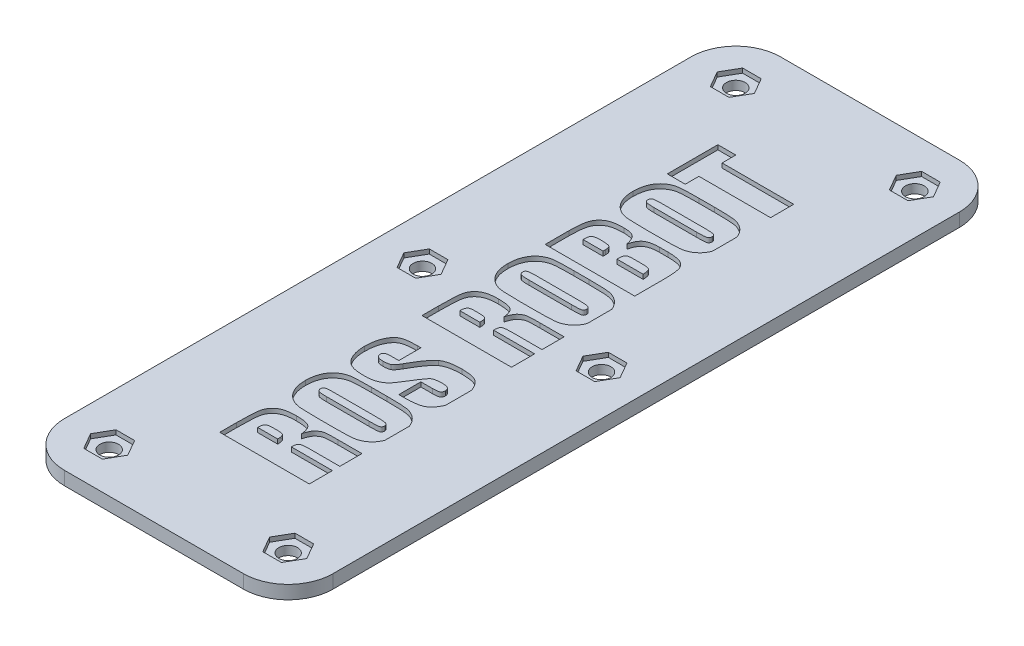
from build123d import *

# Parameters (mm, degrees)
SKETCH1_W           = 60
SKETCH1_H           = 160
BOSS_EXTRUDE1_DEPTH = 3
SKETCH2_R           = 2.09
CUT_EXTRUDE1_DEPTH  = 86.492689746
CUT_EXTRUDE2_DEPTH  = 1
FILLET1_R           = 10
CUT_EXTRUDE3_DEPTH  = 1


with BuildPart() as part:
    # Sketch1 → Boss-Extrude1 (new body)
    with BuildSketch(Plane(origin=(0, 0, 0), x_dir=(1, 0, 0), z_dir=(0, 1, 0))):
        Rectangle(SKETCH1_W, SKETCH1_H)
    extrude(amount=BOSS_EXTRUDE1_DEPTH)

    # Sketch2 → Cut-Extrude1 (cut, through all)
    with BuildSketch(Plane(origin=(0, 3, 0), x_dir=(1, 0, 0), z_dir=(0, 1, 0))):
        with Locations((-20, -70)):
            Circle(SKETCH2_R)
        with Locations((-20, 0)):
            Circle(SKETCH2_R)
        with Locations((-20, 70)):
            Circle(SKETCH2_R)
    cut_extrude1 = extrude(amount=-CUT_EXTRUDE1_DEPTH, mode=Mode.SUBTRACT)

    # Mirror1: Cut-Extrude1 across plane
    add(cut_extrude1.mirror(Plane(origin=(0, 0, 0), x_dir=(0, 0, 1), z_dir=(1, 0, 0))), mode=Mode.SUBTRACT)

    # Sketch3 → Cut-Extrude2 (cut)
    # profile 1 of 8: a face of its own
    with BuildSketch(Plane(origin=(0, 3, 0), x_dir=(1, 0, 0), z_dir=(0, 1, 0))):
        with BuildLine():
            Line((-10, -55.294117647), (10, -55.294117647))
            Line((10, -55.294117647), (10, -50.117647059))
            Line((10, -50.117647059), (0.823529412, -50.117647059))
            add(Edge.make_bspline(
                [(3.235294118, -48.470588235), (2.989040814, -48.472629573), (2.639050732, -48.472609959), (2.199316231, -48.504803837), (1.926897066, -48.533164663), (1.692438703, -48.569281782), (1.49574074, -48.610523448), (1.339038243, -48.665722106), (1.214579141, -48.728929145), (1.113981631, -48.811228735), (1.03929987, -48.923342767), (0.966657804, -49.054244329), (0.919353851, -49.217915347), (0.873311477, -49.403659462), (0.835597841, -49.707286412), (0.823973747, -49.948124989), (0.823529412, -50.117647059)],
                knots=[0, 0, 0, 0, 0.208735031, 0.296167179, 0.37344265, 0.440694545, 0.497112652, 0.543415123, 0.581035154, 0.614932476, 0.652105749, 0.694367553, 0.74131732, 0.795712192, 0.856498699, 1, 1, 1, 1], degree=3))
            Line((3.235294118, -48.470588235), (10, -48.470588235))
            Line((10, -48.470588235), (10, -43.529411765))
            Line((10, -43.529411765), (4.658088235, -43.529411765))
            add(Edge.make_bspline(
                [(-0.573529412, -46.408088235), (-0.508186487, -46.169202547), (-0.415807847, -45.822748493), (-0.253576942, -45.392429256), (-0.12424053, -45.117359412), (0.008181693, -44.872188688), (0.146242268, -44.65674583), (0.298199184, -44.475211831), (0.505595072, -44.279090918), (0.769482386, -44.085338589), (1.073939288, -43.890136431), (1.366818297, -43.747197915), (1.616256033, -43.665317475), (1.84380423, -43.628386957), (2.070329283, -43.598146442), (2.357684941, -43.579047523), (2.703272021, -43.560390596), (3.107774826, -43.546616069), (3.76580814, -43.52957415), (4.289261909, -43.534840608), (4.658088235, -43.529411765)],
                knots=[0, 0, 0, 0, 0.110210274, 0.159198398, 0.204303993, 0.245275902, 0.283065073, 0.3178845, 0.350264175, 0.409777515, 0.463155522, 0.510931222, 0.554366277, 0.579275166, 0.613344402, 0.65597887, 0.707279948, 0.767268001, 0.835955663, 1, 1, 1, 1], degree=3))
            add(Edge.make_bspline(
                [(-4.617647059, -43.529411765), (-4.265347321, -43.523568214), (-3.759919224, -43.547429474), (-3.118182503, -43.602500182), (-2.707546117, -43.670971052), (-2.343153143, -43.74912541), (-2.023822753, -43.845927278), (-1.754303785, -43.967615545), (-1.524564876, -44.105726294), (-1.330409182, -44.274272382), (-1.160503413, -44.475701558), (-1.010392486, -44.712065683), (-0.880561748, -44.983524654), (-0.777601525, -45.29095197), (-0.646430718, -45.763349146), (-0.597468225, -46.144266225), (-0.573529412, -46.408088235)],
                knots=[0, 0, 0, 0, 0.183843892, 0.264214308, 0.336184648, 0.401092358, 0.45878306, 0.510056682, 0.55517248, 0.59828253, 0.64368343, 0.692329227, 0.744143255, 0.800414159, 0.861431347, 1, 1, 1, 1], degree=3))
            add(Edge.make_bspline(
                [(-10, -51.566176471), (-10.002073268, -50.993819944), (-9.992522011, -50.173782937), (-9.961770188, -49.130967301), (-9.934349846, -48.461579038), (-9.893765625, -47.867125834), (-9.846902044, -47.348485673), (-9.793813546, -46.905287107), (-9.727924289, -46.526534008), (-9.642203621, -46.192709029), (-9.529610049, -45.884608598), (-9.3956181, -45.589803188), (-9.228198446, -45.311726309), (-9.031642664, -45.052332013), (-8.815602269, -44.802348856), (-8.564597704, -44.574834978), (-8.290441128, -44.355921653), (-7.977684947, -44.158035206), (-7.6226227, -43.990685169), (-7.226287928, -43.847046859), (-6.786918244, -43.730527587), (-6.30511939, -43.640302786), (-5.579003966, -43.54780148), (-5.009887783, -43.534831682), (-4.617647059, -43.529411765)],
                knots=[0, 0, 0, 0, 0.148881435, 0.213302999, 0.271376625, 0.323137581, 0.368275921, 0.406826982, 0.439217091, 0.468211877, 0.496345732, 0.524443445, 0.552325136, 0.580568943, 0.609027807, 0.638127546, 0.668547056, 0.700208954, 0.734143472, 0.770447799, 0.809729999, 0.852243566, 0.897872275, 1, 1, 1, 1], degree=3))
            Line((-10, -51.566176471), (-10, -55.294117647))
        make_face()
        with BuildLine():
            Line((-2.235294118, -50.117647059), (-6.705882353, -50.117647059))
            add(Edge.make_bspline(
                [(-5.154411765, -48.470588235), (-5.418336948, -48.473249493), (-5.788234319, -48.491488459), (-6.208983424, -48.648984539), (-6.422021915, -48.813415334), (-6.552252293, -49.050216126), (-6.691331049, -49.479623299), (-6.700787332, -49.853765331), (-6.705882353, -50.117647059)],
                knots=[0, 0, 0, 0, 0.296724354, 0.405999103, 0.497474067, 0.590179394, 0.702696619, 1, 1, 1, 1], degree=3))
            Line((-5.154411765, -48.470588235), (-4.047794118, -48.470588235))
            add(Edge.make_bspline(
                [(-2.235294118, -50.117647059), (-2.2410209, -49.859031368), (-2.244911105, -49.494151793), (-2.359520163, -49.070270281), (-2.445519037, -48.867401357), (-2.55713594, -48.745711405), (-2.670238573, -48.667444045), (-2.820402185, -48.608189394), (-3.001543379, -48.557137957), (-3.215789469, -48.518214901), (-3.567218076, -48.475786698), (-3.849445649, -48.476158465), (-4.047794118, -48.470588235)],
                knots=[0, 0, 0, 0, 0.26299036, 0.361622752, 0.442866927, 0.481355846, 0.526610603, 0.580321924, 0.643299483, 0.716253842, 0.799640904, 1, 1, 1, 1], degree=3))
        make_face(mode=Mode.SUBTRACT)
    # profile 2 of 8: a face of its own
    with BuildSketch(Plane(origin=(0, 3, 0), x_dir=(1, 0, 0), z_dir=(0, 1, 0))):
        Polygon((-6, 47.764705882), (10, 47.764705882), (10, 52.941176471), (-6, 52.941176471), (-6, 56), (-10, 56), (-10, 44.705882353), (-6, 44.705882353), align=None)
    # profile 3 of 8: a face of its own
    with BuildSketch(Plane(origin=(0, 3, 0), x_dir=(1, 0, 0), z_dir=(0, 1, 0))):
        with BuildLine():
            add(Edge.make_bspline(
                [(10, 34.798387464), (9.980984118, 34.748947528), (9.878125419, 34.490773842), (9.665995506, 34.04189974), (9.29388391, 33.497728263), (8.86835261, 33.004800818), (8.369272434, 32.590257778), (7.832614548, 32.241182509), (7.264792336, 31.970382533), (6.674408532, 31.776435539), (6.156196354, 31.68103348), (5.704959011, 31.640927748), (5.307854377, 31.611272108), (4.85186231, 31.586476739), (4.338407042, 31.563589566), (3.765971372, 31.55054095), (2.887326127, 31.534957706), (2.198536957, 31.530710798), (1.720588235, 31.529411765)],
                knots=[0.224411446, 0.224411446, 0.224411446, 0.224411446, 0.237202779, 0.291504649, 0.343987522, 0.396025725, 0.44835046, 0.500180972, 0.550381919, 0.599920811, 0.649928359, 0.677302448, 0.709372201, 0.746150888, 0.787647262, 0.833562824, 0.884505076, 1, 1, 1, 1], degree=3))
            Line((10, 34.798387464), (10, 40.27413404))
            add(Edge.make_bspline(
                [(1.720588235, 43.529411765), (2.188717266, 43.524898541), (2.862792337, 43.527597916), (3.724400067, 43.513585944), (4.286760579, 43.492638291), (4.795587242, 43.477264739), (5.249009688, 43.450877889), (5.647384029, 43.421695902), (6.101645014, 43.380381753), (6.624952968, 43.294588086), (7.219368568, 43.107710421), (7.784773996, 42.844615484), (8.318358198, 42.508884233), (8.812591488, 42.107273783), (9.245882126, 41.629826245), (9.620320483, 41.088913194), (9.855282283, 40.623994277), (9.971898719, 40.34504996), (10, 40.27413404)],
                knots=[0, 0, 0, 0, 0.11310055, 0.162848353, 0.208171349, 0.249055911, 0.285827126, 0.317890363, 0.34555357, 0.396029061, 0.44565955, 0.495598169, 0.546282494, 0.597611279, 0.648954578, 0.701516088, 0.756070273, 0.774486187, 0.774486187, 0.774486187, 0.774486187], degree=3))
            Line((1.720588235, 43.529411765), (-1.720588235, 43.529411765))
            add(Edge.make_bspline(
                [(-10.470588235, 37.529411765), (-10.471351287, 38.039260617), (-10.409632236, 38.787713715), (-10.190714791, 39.744932293), (-9.959732893, 40.402613519), (-9.663969879, 41.012578587), (-9.296625615, 41.560723652), (-8.866737602, 42.050148979), (-8.369656032, 42.465400462), (-7.831550666, 42.81302283), (-7.265834752, 43.089453187), (-6.675361322, 43.281308841), (-6.158763212, 43.378686195), (-5.707221304, 43.416729364), (-5.309410488, 43.453767498), (-4.851678447, 43.470262627), (-4.338450104, 43.496189179), (-3.765909196, 43.506679481), (-2.887460519, 43.533073835), (-2.19844543, 43.521822795), (-1.720588235, 43.529411765)],
                knots=[0, 0, 0, 0, 0.123193932, 0.180662712, 0.236860689, 0.291295599, 0.344027448, 0.395846617, 0.448174423, 0.500007975, 0.550340105, 0.599881904, 0.6496013, 0.676976995, 0.709367001, 0.746132344, 0.787631153, 0.833549409, 0.884500674, 1, 1, 1, 1], degree=3))
            add(Edge.make_bspline(
                [(-1.720588235, 31.529411765), (-2.18748944, 31.53391291), (-2.861570976, 31.531219141), (-3.723168413, 31.545315397), (-4.286784378, 31.565743736), (-4.794223549, 31.582937367), (-5.247897112, 31.603396478), (-5.646130949, 31.633658368), (-6.101982975, 31.674025142), (-6.624469402, 31.765639994), (-7.219562523, 31.950533989), (-7.785214435, 32.215513133), (-8.32114813, 32.547664842), (-8.814079121, 32.952950822), (-9.24365518, 33.431977579), (-9.621260416, 33.970332741), (-9.928263659, 34.576530151), (-10.169329369, 35.241134834), (-10.413124021, 36.222889843), (-10.465199955, 37.000791959), (-10.470588235, 37.529411765)],
                knots=[0, 0, 0, 0, 0.112808074, 0.162853494, 0.208177932, 0.249063796, 0.285524951, 0.317884488, 0.345548575, 0.39607688, 0.445708948, 0.495649157, 0.546586122, 0.597688037, 0.649251897, 0.701571856, 0.756127778, 0.812891824, 0.872063415, 1, 1, 1, 1], degree=3))
            Line((-1.720588235, 31.529411765), (1.720588235, 31.529411765))
        make_face()
        with BuildLine():
            Line((4.566176471, 36.705882353), (-4.959558824, 36.705882353))
            add(Edge.make_bspline(
                [(-7.176470588, 37.555147059), (-7.182599475, 37.429104515), (-7.138920866, 37.243468227), (-7.00068513, 37.037160926), (-6.880311142, 36.931046616), (-6.748139917, 36.863099127), (-6.606004763, 36.821896827), (-6.426365541, 36.786174375), (-6.207497569, 36.758825864), (-5.951560006, 36.731214092), (-5.530709236, 36.715263037), (-5.196278933, 36.703509135), (-4.959558824, 36.705882353)],
                knots=[0, 0, 0, 0, 0.141229944, 0.207870292, 0.277367941, 0.319365436, 0.37439268, 0.443449943, 0.525666756, 0.622809696, 0.733417226, 1, 1, 1, 1], degree=3))
            add(Edge.make_bspline(
                [(-4.959558824, 38.352941176), (-5.175303354, 38.352264386), (-5.482932653, 38.346448336), (-5.871602904, 38.333448647), (-6.115480155, 38.314251231), (-6.32757554, 38.292601849), (-6.508580133, 38.26906515), (-6.655852623, 38.235892117), (-6.805984555, 38.190248925), (-6.954005969, 38.106307017), (-7.143059215, 37.907812734), (-7.172463444, 37.690491789), (-7.176470588, 37.555147059)],
                knots=[0, 0, 0, 0, 0.245381507, 0.350013726, 0.44228014, 0.523562531, 0.592561096, 0.649714338, 0.695120491, 0.770678918, 0.840725622, 1, 1, 1, 1], degree=3))
            Line((-4.959558824, 38.352941176), (4.415441176, 38.352941176))
            add(Edge.make_bspline(
                [(7.176470588, 37.518382353), (7.174783202, 37.666908905), (7.135583707, 37.909491269), (6.90741784, 38.117636651), (6.72767083, 38.197953932), (6.545782298, 38.244701444), (6.363187256, 38.270798373), (6.140129485, 38.296901656), (5.875332367, 38.319122143), (5.568703908, 38.331807347), (5.07734344, 38.347878814), (4.688733611, 38.351487647), (4.415441176, 38.352941176)],
                knots=[0, 0, 0, 0, 0.144508876, 0.209626381, 0.282206802, 0.327424738, 0.385694884, 0.455209163, 0.538351522, 0.635125416, 0.743352513, 1, 1, 1, 1], degree=3))
            add(Edge.make_bspline(
                [(4.566176471, 36.705882353), (4.834553498, 36.710406485), (5.215756676, 36.707612663), (5.695131762, 36.721256936), (5.990199181, 36.742396681), (6.243241553, 36.757088503), (6.454082367, 36.783640941), (6.62251498, 36.811484319), (6.78643941, 36.851258818), (6.945563097, 36.933796701), (7.143111825, 37.144434325), (7.175688722, 37.373741892), (7.176470588, 37.518382353)],
                knots=[0, 0, 0, 0, 0.263965983, 0.374910105, 0.471520145, 0.554902094, 0.624118814, 0.680393612, 0.722784308, 0.789641701, 0.853612109, 1, 1, 1, 1], degree=3))
        make_face(mode=Mode.SUBTRACT)
    # profile 4 of 8: a face of its own
    with BuildSketch(Plane(origin=(0, 3, 0), x_dir=(1, 0, 0), z_dir=(0, 1, 0))):
        with BuildLine():
            Line((-10, 17.411764706), (10, 17.411764706))
            Line((10, 17.411764706), (10, 23.492647059))
            add(Edge.make_bspline(
                [(5.242647059, 29.647058824), (5.562644532, 29.646812462), (6.026827764, 29.635192846), (6.623446822, 29.584586988), (7.021215228, 29.534951021), (7.385674001, 29.468197782), (7.716316083, 29.388564201), (8.015408276, 29.293780096), (8.363234175, 29.14960596), (8.74665424, 28.927366376), (9.131049832, 28.58171603), (9.433497549, 28.164193669), (9.621221942, 27.757535454), (9.729179675, 27.375531482), (9.802121909, 27.017947482), (9.861860948, 26.594226079), (9.913076125, 26.102472039), (9.951814242, 25.545753948), (9.994365669, 24.668447698), (9.994351205, 23.976648658), (10, 23.492647059)],
                knots=[0, 0, 0, 0, 0.102268902, 0.148252963, 0.191287831, 0.230306444, 0.266587991, 0.299901488, 0.330446165, 0.386794172, 0.440584461, 0.494394702, 0.550463064, 0.582683787, 0.621084401, 0.666995037, 0.719365379, 0.779044003, 0.845298245, 1, 1, 1, 1], degree=3))
            Line((5.242647059, 29.647058824), (3.363970588, 29.647058824))
            add(Edge.make_bspline(
                [(-0.941176471, 26.632352941), (-0.878335362, 26.90637568), (-0.765762115, 27.300700064), (-0.56288787, 27.787632125), (-0.402673098, 28.106896555), (-0.22051409, 28.387346881), (-0.026797613, 28.636657687), (0.187839066, 28.84865708), (0.425229115, 29.024980417), (0.68715419, 29.172098002), (0.975506704, 29.302524236), (1.296825083, 29.40661881), (1.648075843, 29.494987923), (2.031115772, 29.56500852), (2.606138526, 29.628167049), (3.054773253, 29.646098611), (3.363970588, 29.647058824)],
                knots=[0, 0, 0, 0, 0.144042592, 0.209308729, 0.269932359, 0.32668049, 0.38029181, 0.431325131, 0.480651429, 0.531246854, 0.584898562, 0.642449522, 0.703940699, 0.770287073, 0.84166898, 1, 1, 1, 1], degree=3))
            add(Edge.make_bspline(
                [(-4.393382353, 29.411764706), (-4.126990133, 29.41598386), (-3.743106544, 29.396222444), (-3.256066937, 29.334964148), (-2.937604777, 29.279879292), (-2.653622433, 29.196253765), (-2.398933419, 29.104626632), (-2.178448506, 28.988432112), (-1.984982888, 28.854388338), (-1.816338677, 28.689065406), (-1.655843197, 28.498171445), (-1.516177065, 28.26689136), (-1.378311297, 28.007448391), (-1.248919057, 27.713445555), (-1.096259944, 27.252695911), (-0.993792729, 26.888687302), (-0.941176471, 26.632352941)],
                knots=[0, 0, 0, 0, 0.159635238, 0.229971647, 0.294226611, 0.35304997, 0.407212491, 0.456168779, 0.502023537, 0.547742778, 0.59730697, 0.651109669, 0.709268858, 0.77341036, 0.843331301, 1, 1, 1, 1], degree=3))
            add(Edge.make_bspline(
                [(-10, 22.716911765), (-9.995453326, 23.110291275), (-9.992088598, 23.681900263), (-9.952686927, 24.418555323), (-9.907114319, 24.913515961), (-9.856950367, 25.371064597), (-9.796114632, 25.791058651), (-9.718840383, 26.172456155), (-9.630921893, 26.520669601), (-9.523713394, 26.8423759), (-9.391200269, 27.143434389), (-9.23545347, 27.428259898), (-9.058703752, 27.698735988), (-8.855241863, 27.953140614), (-8.627607062, 28.191746973), (-8.374983504, 28.413745054), (-8.097680328, 28.621705733), (-7.786202266, 28.812643321), (-7.430102042, 28.973365406), (-7.029330489, 29.108122433), (-6.587251999, 29.22181161), (-6.099989949, 29.30427764), (-5.366465202, 29.389442028), (-4.791042127, 29.41614622), (-4.393382353, 29.411764706)],
                knots=[0, 0, 0, 0, 0.114375021, 0.166108066, 0.214389793, 0.258843936, 0.299904114, 0.337700596, 0.371916123, 0.404247528, 0.436150213, 0.467395744, 0.49851919, 0.529953016, 0.56195301, 0.594258892, 0.62760283, 0.662610335, 0.70023013, 0.740899013, 0.785395956, 0.832776928, 0.884431414, 1, 1, 1, 1], degree=3))
            Line((-10, 22.716911765), (-10, 17.411764706))
        make_face()
        with BuildLine():
            Line((-2.235294118, 22.588235294), (-6.705882353, 22.588235294))
            add(Edge.make_bspline(
                [(-4.794117647, 24.470588235), (-5.062170788, 24.473601667), (-5.431207161, 24.454740397), (-5.874896836, 24.37769061), (-6.108912695, 24.290930564), (-6.287926206, 24.18512451), (-6.427443444, 24.065629164), (-6.534581346, 23.932108827), (-6.604626234, 23.771096089), (-6.646964318, 23.56915724), (-6.693594331, 23.171954452), (-6.70169016, 22.835840711), (-6.705882353, 22.588235294)],
                knots=[0, 0, 0, 0, 0.246773781, 0.340005048, 0.413618877, 0.475394665, 0.530632455, 0.582131195, 0.631661098, 0.690822181, 0.771635832, 1, 1, 1, 1], degree=3))
            add(Edge.make_bspline(
                [(-2.246323529, 23.161764706), (-2.243112667, 23.394000556), (-2.271126629, 23.720444106), (-2.440251538, 24.083575852), (-2.592544184, 24.230993467), (-2.752742071, 24.301053962), (-2.914078937, 24.349390316), (-3.120807287, 24.381402351), (-3.370568825, 24.415860115), (-3.663910927, 24.439841122), (-4.142980969, 24.465850417), (-4.524499949, 24.47015933), (-4.794117647, 24.470588235)],
                knots=[0, 0, 0, 0, 0.207117208, 0.283923184, 0.350830951, 0.389245474, 0.438074134, 0.499906873, 0.574464838, 0.661754019, 0.760816726, 1, 1, 1, 1], degree=3))
            add(Edge.make_bspline(
                [(-2.235294118, 22.588235294), (-2.242972169, 22.874959549), (-2.246323529, 23.161764706)],
                knots=[0, 0, 0, 1, 1, 1], degree=2))
        make_face(mode=Mode.SUBTRACT)
        with BuildLine():
            Line((6.705882353, 22.588235294), (0.823529412, 22.588235294))
            add(Edge.make_bspline(
                [(2.783088235, 24.470588235), (2.580992751, 24.470303896), (2.291650025, 24.467503211), (1.931159289, 24.42775611), (1.707540562, 24.403304673), (1.520190342, 24.3573331), (1.363179519, 24.308705054), (1.24024349, 24.246433972), (1.143526711, 24.173634658), (1.073281433, 24.075604763), (1.016524158, 23.952965692), (0.965155439, 23.800026496), (0.922704046, 23.616434295), (0.886469189, 23.402786296), (0.845490318, 23.057438026), (0.830566506, 22.78210724), (0.823529412, 22.588235294)],
                knots=[0, 0, 0, 0, 0.18234372, 0.260036521, 0.32688627, 0.384748242, 0.433641625, 0.474638114, 0.508443963, 0.541575631, 0.582078258, 0.629925201, 0.686712704, 0.751712351, 0.82513553, 1, 1, 1, 1], degree=3))
            Line((2.783088235, 24.470588235), (4.746323529, 24.470588235))
            add(Edge.make_bspline(
                [(6.705882353, 22.588235294), (6.697406962, 22.77211117), (6.686457896, 23.035946827), (6.639035104, 23.366082296), (6.600446576, 23.57431779), (6.548534374, 23.75473471), (6.491147804, 23.909241382), (6.426347677, 24.037580991), (6.345277665, 24.139521751), (6.242531072, 24.219815984), (6.116989222, 24.290513523), (5.958992317, 24.342371017), (5.774048501, 24.391465703), (5.558475797, 24.426125537), (5.212916143, 24.460777173), (4.93906262, 24.475126558), (4.746323529, 24.470588235)],
                knots=[0, 0, 0, 0, 0.168583806, 0.241049478, 0.305039014, 0.362178465, 0.412572109, 0.455707222, 0.493180931, 0.530654639, 0.574325613, 0.624331078, 0.682257189, 0.749354057, 0.823771208, 1, 1, 1, 1], degree=3))
        make_face(mode=Mode.SUBTRACT)
    # profile 5 of 8: a face of its own
    with BuildSketch(Plane(origin=(0, 3, 0), x_dir=(1, 0, 0), z_dir=(0, 1, 0))):
        with BuildLine():
            add(Edge.make_bspline(
                [(10, 6.798387464), (9.980984118, 6.748947528), (9.878125419, 6.490773842), (9.665995506, 6.04189974), (9.29388391, 5.497728263), (8.86835261, 5.004800818), (8.369272434, 4.590257778), (7.832614548, 4.241182509), (7.264792336, 3.970382533), (6.674408532, 3.776435539), (6.156196354, 3.68103348), (5.704959011, 3.640927748), (5.307854377, 3.611272108), (4.85186231, 3.586476739), (4.338407042, 3.563589566), (3.765971372, 3.55054095), (2.887326127, 3.534957706), (2.198536957, 3.530710798), (1.720588235, 3.529411765)],
                knots=[0.224411446, 0.224411446, 0.224411446, 0.224411446, 0.237202779, 0.291504649, 0.343987522, 0.396025725, 0.44835046, 0.500180972, 0.550381919, 0.599920811, 0.649928359, 0.677302448, 0.709372201, 0.746150888, 0.787647262, 0.833562824, 0.884505076, 1, 1, 1, 1], degree=3))
            Line((10, 6.798387464), (10, 12.27413404))
            add(Edge.make_bspline(
                [(1.720588235, 15.529411765), (2.188717266, 15.524898541), (2.862792337, 15.527597916), (3.724400067, 15.513585944), (4.286760579, 15.492638291), (4.795587242, 15.477264739), (5.249009688, 15.450877889), (5.647384029, 15.421695902), (6.101645014, 15.380381753), (6.624952968, 15.294588086), (7.219368568, 15.107710421), (7.784773996, 14.844615484), (8.318358198, 14.508884233), (8.812591488, 14.107273783), (9.245882126, 13.629826245), (9.620320483, 13.088913194), (9.855282283, 12.623994277), (9.971898719, 12.34504996), (10, 12.27413404)],
                knots=[0, 0, 0, 0, 0.11310055, 0.162848353, 0.208171349, 0.249055911, 0.285827126, 0.317890363, 0.34555357, 0.396029061, 0.44565955, 0.495598169, 0.546282494, 0.597611279, 0.648954578, 0.701516088, 0.756070273, 0.774486187, 0.774486187, 0.774486187, 0.774486187], degree=3))
            Line((1.720588235, 15.529411765), (-1.720588235, 15.529411765))
            add(Edge.make_bspline(
                [(-10.470588235, 9.529411765), (-10.471351287, 10.039260617), (-10.409632236, 10.787713715), (-10.190714791, 11.744932293), (-9.959732893, 12.402613519), (-9.663969879, 13.012578587), (-9.296625615, 13.560723652), (-8.866737602, 14.050148979), (-8.369656032, 14.465400462), (-7.831550666, 14.81302283), (-7.265834752, 15.089453187), (-6.675361322, 15.281308841), (-6.158763212, 15.378686195), (-5.707221304, 15.416729364), (-5.309410488, 15.453767498), (-4.851678447, 15.470262627), (-4.338450104, 15.496189179), (-3.765909196, 15.506679481), (-2.887460519, 15.533073835), (-2.19844543, 15.521822795), (-1.720588235, 15.529411765)],
                knots=[0, 0, 0, 0, 0.123193932, 0.180662712, 0.236860689, 0.291295599, 0.344027448, 0.395846617, 0.448174423, 0.500007975, 0.550340105, 0.599881904, 0.6496013, 0.676976995, 0.709367001, 0.746132344, 0.787631153, 0.833549409, 0.884500674, 1, 1, 1, 1], degree=3))
            add(Edge.make_bspline(
                [(-1.720588235, 3.529411765), (-2.18748944, 3.53391291), (-2.861570976, 3.531219141), (-3.723168413, 3.545315397), (-4.286784378, 3.565743736), (-4.794223549, 3.582937367), (-5.247897112, 3.603396478), (-5.646130949, 3.633658368), (-6.101982975, 3.674025142), (-6.624469402, 3.765639994), (-7.219562523, 3.950533989), (-7.785214435, 4.215513133), (-8.32114813, 4.547664842), (-8.814079121, 4.952950822), (-9.24365518, 5.431977579), (-9.621260416, 5.970332741), (-9.928263659, 6.576530151), (-10.169329369, 7.241134834), (-10.413124021, 8.222889843), (-10.465199955, 9.000791959), (-10.470588235, 9.529411765)],
                knots=[0, 0, 0, 0, 0.112808074, 0.162853494, 0.208177932, 0.249063796, 0.285524951, 0.317884488, 0.345548575, 0.39607688, 0.445708948, 0.495649157, 0.546586122, 0.597688037, 0.649251897, 0.701571856, 0.756127778, 0.812891824, 0.872063415, 1, 1, 1, 1], degree=3))
            Line((-1.720588235, 3.529411765), (1.720588235, 3.529411765))
        make_face()
        with BuildLine():
            Line((4.566176471, 8.705882353), (-4.959558824, 8.705882353))
            add(Edge.make_bspline(
                [(-7.176470588, 9.555147059), (-7.182599475, 9.429104515), (-7.138920866, 9.243468227), (-7.00068513, 9.037160926), (-6.880311142, 8.931046616), (-6.748139917, 8.863099127), (-6.606004763, 8.821896827), (-6.426365541, 8.786174375), (-6.207497569, 8.758825864), (-5.951560006, 8.731214092), (-5.530709236, 8.715263037), (-5.196278933, 8.703509135), (-4.959558824, 8.705882353)],
                knots=[0, 0, 0, 0, 0.141229944, 0.207870292, 0.277367941, 0.319365436, 0.37439268, 0.443449943, 0.525666756, 0.622809696, 0.733417226, 1, 1, 1, 1], degree=3))
            add(Edge.make_bspline(
                [(-4.959558824, 10.352941176), (-5.175303354, 10.352264386), (-5.482932653, 10.346448336), (-5.871602904, 10.333448647), (-6.115480155, 10.314251231), (-6.32757554, 10.292601849), (-6.508580133, 10.26906515), (-6.655852623, 10.235892117), (-6.805984555, 10.190248925), (-6.954005969, 10.106307017), (-7.143059215, 9.907812734), (-7.172463444, 9.690491789), (-7.176470588, 9.555147059)],
                knots=[0, 0, 0, 0, 0.245381507, 0.350013726, 0.44228014, 0.523562531, 0.592561096, 0.649714338, 0.695120491, 0.770678918, 0.840725622, 1, 1, 1, 1], degree=3))
            Line((-4.959558824, 10.352941176), (4.415441176, 10.352941176))
            add(Edge.make_bspline(
                [(7.176470588, 9.518382353), (7.174783202, 9.666908905), (7.135583707, 9.909491269), (6.90741784, 10.117636651), (6.72767083, 10.197953932), (6.545782298, 10.244701444), (6.363187256, 10.270798373), (6.140129485, 10.296901656), (5.875332367, 10.319122143), (5.568703908, 10.331807347), (5.07734344, 10.347878814), (4.688733611, 10.351487647), (4.415441176, 10.352941176)],
                knots=[0, 0, 0, 0, 0.144508876, 0.209626381, 0.282206802, 0.327424738, 0.385694884, 0.455209163, 0.538351522, 0.635125416, 0.743352513, 1, 1, 1, 1], degree=3))
            add(Edge.make_bspline(
                [(4.566176471, 8.705882353), (4.834553498, 8.710406485), (5.215756676, 8.707612663), (5.695131762, 8.721256936), (5.990199181, 8.742396681), (6.243241553, 8.757088503), (6.454082367, 8.783640941), (6.62251498, 8.811484319), (6.78643941, 8.851258818), (6.945563097, 8.933796701), (7.143111825, 9.144434325), (7.175688722, 9.373741892), (7.176470588, 9.518382353)],
                knots=[0, 0, 0, 0, 0.263965983, 0.374910105, 0.471520145, 0.554902094, 0.624118814, 0.680393612, 0.722784308, 0.789641701, 0.853612109, 1, 1, 1, 1], degree=3))
        make_face(mode=Mode.SUBTRACT)
    # profile 6 of 8: a face of its own
    with BuildSketch(Plane(origin=(0, 3, 0), x_dir=(1, 0, 0), z_dir=(0, 1, 0))):
        with BuildLine():
            Line((-10, -10.117647059), (10, -10.117647059))
            Line((10, -10.117647059), (10, -4.941176471))
            Line((10, -4.941176471), (0.823529412, -4.941176471))
            add(Edge.make_bspline(
                [(3.235294118, -3.294117647), (2.989040814, -3.296158985), (2.639050732, -3.296139371), (2.199316231, -3.328333249), (1.926897066, -3.356694074), (1.692438703, -3.392811194), (1.49574074, -3.43405286), (1.339038243, -3.489251518), (1.214579141, -3.552458557), (1.113981631, -3.634758147), (1.03929987, -3.746872179), (0.966657804, -3.877773741), (0.919353851, -4.041444759), (0.873311477, -4.227188874), (0.835597841, -4.530815824), (0.823973747, -4.771654401), (0.823529412, -4.941176471)],
                knots=[0, 0, 0, 0, 0.208735031, 0.296167179, 0.37344265, 0.440694545, 0.497112652, 0.543415123, 0.581035154, 0.614932476, 0.652105749, 0.694367553, 0.74131732, 0.795712192, 0.856498699, 1, 1, 1, 1], degree=3))
            Line((3.235294118, -3.294117647), (10, -3.294117647))
            Line((10, -3.294117647), (10, 1.647058824))
            Line((10, 1.647058824), (4.658088235, 1.647058824))
            add(Edge.make_bspline(
                [(-0.573529412, -1.231617647), (-0.508186487, -0.992731958), (-0.415807847, -0.646277905), (-0.253576942, -0.215958668), (-0.12424053, 0.059111176), (0.008181693, 0.3042819), (0.146242268, 0.519724758), (0.298199184, 0.701258757), (0.505595072, 0.89737967), (0.769482386, 1.091132), (1.073939288, 1.286334157), (1.366818297, 1.429272673), (1.616256033, 1.511153114), (1.84380423, 1.548083631), (2.070329283, 1.578324146), (2.357684941, 1.597423065), (2.703272021, 1.616079992), (3.107774826, 1.629854519), (3.76580814, 1.646896438), (4.289261909, 1.64162998), (4.658088235, 1.647058824)],
                knots=[0, 0, 0, 0, 0.110210274, 0.159198398, 0.204303993, 0.245275902, 0.283065073, 0.3178845, 0.350264175, 0.409777515, 0.463155522, 0.510931222, 0.554366277, 0.579275166, 0.613344402, 0.65597887, 0.707279948, 0.767268001, 0.835955663, 1, 1, 1, 1], degree=3))
            add(Edge.make_bspline(
                [(-4.617647059, 1.647058824), (-4.265347321, 1.652902374), (-3.759919224, 1.629041114), (-3.118182503, 1.573970406), (-2.707546117, 1.505499536), (-2.343153143, 1.427345178), (-2.023822753, 1.33054331), (-1.754303785, 1.208855044), (-1.524564876, 1.070744294), (-1.330409182, 0.902198206), (-1.160503413, 0.70076903), (-1.010392486, 0.464404905), (-0.880561748, 0.192945934), (-0.777601525, -0.114481382), (-0.646430718, -0.586878558), (-0.597468225, -0.967795637), (-0.573529412, -1.231617647)],
                knots=[0, 0, 0, 0, 0.183843892, 0.264214308, 0.336184648, 0.401092358, 0.45878306, 0.510056682, 0.55517248, 0.59828253, 0.64368343, 0.692329227, 0.744143255, 0.800414159, 0.861431347, 1, 1, 1, 1], degree=3))
            add(Edge.make_bspline(
                [(-10, -6.389705882), (-10.002073268, -5.817349355), (-9.992522011, -4.997312349), (-9.961770188, -3.954496712), (-9.934349846, -3.28510845), (-9.893765625, -2.690655246), (-9.846902044, -2.172015085), (-9.793813546, -1.728816518), (-9.727924289, -1.35006342), (-9.642203621, -1.016238441), (-9.529610049, -0.70813801), (-9.3956181, -0.4133326), (-9.228198446, -0.135255721), (-9.031642664, 0.124138575), (-8.815602269, 0.374121732), (-8.564597704, 0.60163561), (-8.290441128, 0.820548935), (-7.977684947, 1.018435383), (-7.6226227, 1.185785419), (-7.226287928, 1.329423729), (-6.786918244, 1.445943001), (-6.30511939, 1.536167802), (-5.579003966, 1.628669108), (-5.009887783, 1.641638907), (-4.617647059, 1.647058824)],
                knots=[0, 0, 0, 0, 0.148881435, 0.213302999, 0.271376625, 0.323137581, 0.368275921, 0.406826982, 0.439217091, 0.468211877, 0.496345732, 0.524443445, 0.552325136, 0.580568943, 0.609027807, 0.638127546, 0.668547056, 0.700208954, 0.734143472, 0.770447799, 0.809729999, 0.852243566, 0.897872275, 1, 1, 1, 1], degree=3))
            Line((-10, -6.389705882), (-10, -10.117647059))
        make_face()
        with BuildLine():
            Line((-2.235294118, -4.941176471), (-6.705882353, -4.941176471))
            add(Edge.make_bspline(
                [(-5.154411765, -3.294117647), (-5.418336948, -3.296778905), (-5.788234319, -3.315017871), (-6.208983424, -3.472513951), (-6.422021915, -3.636944745), (-6.552252293, -3.873745538), (-6.691331049, -4.303152711), (-6.700787332, -4.677294743), (-6.705882353, -4.941176471)],
                knots=[0, 0, 0, 0, 0.296724354, 0.405999103, 0.497474067, 0.590179394, 0.702696619, 1, 1, 1, 1], degree=3))
            Line((-5.154411765, -3.294117647), (-4.047794118, -3.294117647))
            add(Edge.make_bspline(
                [(-2.235294118, -4.941176471), (-2.2410209, -4.68256078), (-2.244911105, -4.317681205), (-2.359520163, -3.893799693), (-2.445519037, -3.690930769), (-2.55713594, -3.569240816), (-2.670238573, -3.490973456), (-2.820402185, -3.431718806), (-3.001543379, -3.380667369), (-3.215789469, -3.341744313), (-3.567218076, -3.29931611), (-3.849445649, -3.299687877), (-4.047794118, -3.294117647)],
                knots=[0, 0, 0, 0, 0.26299036, 0.361622752, 0.442866927, 0.481355846, 0.526610603, 0.580321924, 0.643299483, 0.716253842, 0.799640904, 1, 1, 1, 1], degree=3))
        make_face(mode=Mode.SUBTRACT)
    # profile 7 of 8: a face of its own
    with BuildSketch(Plane(origin=(0, 3, 0), x_dir=(1, 0, 0), z_dir=(0, 1, 0))):
        with BuildLine():
            add(Edge.make_bspline(
                [(10, -24.797933282), (9.954712321, -24.921932371), (9.853998918, -25.178630702), (9.66764177, -25.54941368), (9.45914843, -25.909340871), (9.236781684, -26.239598194), (8.999069687, -26.536780418), (8.749649466, -26.802707831), (8.484081059, -27.036104581), (8.20217236, -27.235043433), (7.909621911, -27.406170353), (7.596805317, -27.538786556), (7.263292856, -27.650101611), (6.90106848, -27.745228003), (6.504964457, -27.819969672), (6.077327082, -27.887510977), (5.615954124, -27.937340123), (4.935999227, -27.987821131), (4.409444545, -27.999784328), (4.047794118, -28)],
                knots=[0.286193131, 0.286193131, 0.286193131, 0.286193131, 0.324638117, 0.36647626, 0.406957631, 0.445779823, 0.482361605, 0.517724123, 0.551885446, 0.58517537, 0.618126535, 0.650430981, 0.683967027, 0.720515684, 0.759451015, 0.801366796, 0.846634442, 0.894614826, 1, 1, 1, 1], degree=3))
            Line((10, -24.797933282), (10, -19.028387447))
            add(Edge.make_bspline(
                [(4.875, -16), (5.212235924, -15.998308673), (5.699832415, -16.013532504), (6.325640635, -16.070067848), (6.742235131, -16.122095276), (7.123627446, -16.196886289), (7.468984682, -16.283838341), (7.780065055, -16.385011418), (8.058285778, -16.508705216), (8.313949794, -16.656009443), (8.556973121, -16.827662161), (8.785816927, -17.033817412), (9.006723407, -17.265352113), (9.217895321, -17.528024577), (9.413112982, -17.823674404), (9.607942, -18.143294227), (9.805748963, -18.547089161), (9.932257587, -18.847030526), (10, -19.028387447)],
                knots=[0, 0, 0, 0, 0.107324697, 0.155096555, 0.199938691, 0.240857979, 0.278693097, 0.313224336, 0.344823203, 0.375394585, 0.406993451, 0.43931565, 0.473244831, 0.508753256, 0.546394925, 0.585922737, 0.62778092, 0.689366758, 0.689366758, 0.689366758, 0.689366758], degree=3))
            add(Edge.make_bspline(
                [(0.566176471, -16.9375), (0.806043702, -16.77003858), (1.211465721, -16.558891693), (1.810580448, -16.357268829), (2.324256078, -16.225991682), (2.890649038, -16.123687479), (3.744627839, -16.024389707), (4.413744653, -15.999987273), (4.875, -16)],
                knots=[0, 0, 0, 0, 0.19599711, 0.304678492, 0.423526134, 0.551406495, 0.69050554, 1, 1, 1, 1], degree=3))
            add(Edge.make_bspline(
                [(-2.783088235, -21.529411765), (-2.473367773, -20.970305965), (-2.018375264, -20.172909867), (-1.388063598, -19.189740388), (-0.956308764, -18.573813667), (-0.552231412, -18.038870295), (-0.067679288, -17.480460132), (0.302443276, -17.119384349), (0.566176471, -16.9375)],
                knots=[0, 0, 0, 0, 0.335277756, 0.481299959, 0.612364063, 0.729738585, 0.83271341, 1, 1, 1, 1], degree=3))
            add(Edge.make_bspline(
                [(-4.007352941, -23.044117647), (-3.908726816, -22.995337919), (-3.763485988, -22.89204074), (-3.578339598, -22.716456053), (-3.431720611, -22.539134867), (-3.274066191, -22.334418219), (-3.049218613, -21.999638416), (-2.892754352, -21.722308394), (-2.783088235, -21.529411765)],
                knots=[0, 0, 0, 0, 0.16675308, 0.269572473, 0.387215686, 0.516181657, 0.662459423, 1, 1, 1, 1], degree=3))
            add(Edge.make_bspline(
                [(-5.573529412, -23.294117647), (-5.268536496, -23.296326908), (-4.735456987, -23.266606811), (-4.213860364, -23.143358219), (-4.007352941, -23.044117647)],
                knots=[0, 0, 0, 0, 0.572651319, 1, 1, 1, 1], degree=3))
            add(Edge.make_bspline(
                [(-7.176470588, -22.272058824), (-7.175318321, -22.422382216), (-7.133916453, -22.652559624), (-6.956363272, -22.898626556), (-6.777858689, -23.049357016), (-6.547345801, -23.163822977), (-6.142731079, -23.266997244), (-5.81087743, -23.300706927), (-5.573529412, -23.294117647)],
                knots=[0, 0, 0, 0, 0.212113464, 0.31285869, 0.41856281, 0.535755935, 0.669150346, 1, 1, 1, 1], degree=3))
            add(Edge.make_bspline(
                [(-5.463235294, -21.411764706), (-5.764999618, -21.411775508), (-6.172259272, -21.420944293), (-6.645795321, -21.504577171), (-6.867179393, -21.59295536), (-7.015763217, -21.718292422), (-7.143674268, -21.940278977), (-7.181903344, -22.135550089), (-7.176470588, -22.272058824)],
                knots=[0, 0, 0, 0, 0.412530825, 0.5543248, 0.654755758, 0.734265772, 0.814634242, 1, 1, 1, 1], degree=3))
            Line((-5.463235294, -21.411764706), (-3.882352941, -21.411764706))
            Line((-3.882352941, -21.411764706), (-3.882352941, -16.470588235))
            Line((-3.882352941, -16.470588235), (-4.6875, -16.470588235))
            add(Edge.make_bspline(
                [(-10.470588235, -22.433823529), (-10.468055857, -22.099065103), (-10.45338162, -21.605945973), (-10.383236947, -20.964085), (-10.310475123, -20.511039039), (-10.213647039, -20.077159513), (-10.102043994, -19.661176237), (-9.964067719, -19.266804184), (-9.811063405, -18.891644607), (-9.63946446, -18.542127161), (-9.456959463, -18.220290347), (-9.258542216, -17.933561399), (-9.061274222, -17.668635547), (-8.839161064, -17.446049206), (-8.616983988, -17.2427572), (-8.37698945, -17.07859539), (-8.122327288, -16.940479705), (-7.838398187, -16.830854873), (-7.51975516, -16.730671229), (-7.154877727, -16.652900468), (-6.748162271, -16.581526248), (-6.294893947, -16.532829805), (-5.603934436, -16.481907954), (-5.062596295, -16.470960066), (-4.6875, -16.470588235)],
                knots=[0, 0, 0, 0, 0.103074516, 0.1516425, 0.198645931, 0.244221725, 0.288418755, 0.331122695, 0.372729792, 0.413046579, 0.450895281, 0.486465125, 0.520340719, 0.552350623, 0.583079291, 0.612898617, 0.641587226, 0.672055515, 0.706414833, 0.744299228, 0.786776018, 0.833469693, 0.884529575, 1, 1, 1, 1], degree=3))
            add(Edge.make_bspline(
                [(-4.786764706, -28.235294118), (-5.148252189, -28.229904379), (-5.672108777, -28.222936356), (-6.342020821, -28.155500003), (-6.786560757, -28.091071009), (-7.192892425, -28.006245663), (-7.561802534, -27.906291969), (-7.889279126, -27.780339706), (-8.183003162, -27.639202273), (-8.448602585, -27.474416935), (-8.693163012, -27.285392797), (-8.929597443, -27.079329609), (-9.143134685, -26.842812469), (-9.347943873, -26.586901064), (-9.538843121, -26.308886347), (-9.71100803, -26.005284687), (-9.9259027, -25.56649327), (-10.146603568, -24.965093143), (-10.411380502, -23.885130997), (-10.470239671, -23.0240668), (-10.470588235, -22.433823529)],
                knots=[0, 0, 0, 0, 0.115094371, 0.166420003, 0.214115061, 0.257929727, 0.298417601, 0.335563099, 0.369390983, 0.401957355, 0.434786392, 0.467650138, 0.501587937, 0.535990613, 0.571893796, 0.608743473, 0.646930183, 0.727243377, 0.811970216, 1, 1, 1, 1], degree=3))
            add(Edge.make_bspline(
                [(1.323529412, -23.977941176), (1.131175782, -24.294407689), (0.853854405, -24.747091531), (0.486700712, -25.315444229), (0.246545695, -25.677903122), (0.023994059, -25.995249819), (-0.173199106, -26.270775338), (-0.348922133, -26.504176854), (-0.560178172, -26.756225593), (-0.838522668, -27.032061417), (-1.219833144, -27.321955364), (-1.657111427, -27.582564064), (-2.149901427, -27.816746262), (-2.707855507, -28.01086208), (-3.591829962, -28.187012068), (-4.29540431, -28.241859841), (-4.786764706, -28.235294118)],
                knots=[0, 0, 0, 0, 0.139505929, 0.199942303, 0.254866781, 0.303272613, 0.345933972, 0.382494964, 0.413288554, 0.469758671, 0.52967984, 0.593250504, 0.661184865, 0.734906166, 0.815121063, 1, 1, 1, 1], degree=3))
            add(Edge.make_bspline(
                [(3.125, -21.422794118), (3.006688611, -21.527846739), (2.832011809, -21.723714843), (2.59856985, -22.027378176), (2.386228715, -22.323150848), (2.145768995, -22.663696157), (1.785720161, -23.219010231), (1.514192243, -23.665593102), (1.323529412, -23.977941176)],
                knots=[0, 0, 0, 0, 0.151178731, 0.250672725, 0.366592017, 0.499698309, 0.649696987, 1, 1, 1, 1], degree=3))
            add(Edge.make_bspline(
                [(5.507352941, -20.941176471), (5.230081296, -20.940709092), (4.833506149, -20.953623972), (4.331545195, -21.000787275), (4.014448686, -21.058517267), (3.733424676, -21.119961985), (3.432091637, -21.228045492), (3.23105503, -21.330156307), (3.125, -21.422794118)],
                knots=[0, 0, 0, 0, 0.336680385, 0.481832826, 0.611778822, 0.728036552, 0.830669431, 1, 1, 1, 1], degree=3))
            add(Edge.make_bspline(
                [(7.176470588, -22.055147059), (7.179717402, -21.886459311), (7.131916095, -21.634584302), (6.943960215, -21.361763952), (6.7516419, -21.204657804), (6.511030871, -21.082668623), (6.094038912, -20.966808099), (5.749965053, -20.942035384), (5.507352941, -20.941176471)],
                knots=[0, 0, 0, 0, 0.223438647, 0.325746663, 0.431376903, 0.547857623, 0.679404012, 1, 1, 1, 1], degree=3))
            add(Edge.make_bspline(
                [(5.297794118, -23.058823529), (5.479444625, -23.061330484), (5.737799236, -23.049017381), (6.065711905, -23.033549614), (6.271102852, -23.004726), (6.451745816, -22.979951789), (6.603092758, -22.937095221), (6.730061315, -22.895293432), (6.862832994, -22.827664593), (6.993662718, -22.711681339), (7.150620917, -22.454353006), (7.172923046, -22.215061065), (7.176470588, -22.055147059)],
                knots=[0, 0, 0, 0, 0.221449353, 0.31585969, 0.400263121, 0.474516094, 0.538002798, 0.591926172, 0.637412015, 0.719012888, 0.801608182, 1, 1, 1, 1], degree=3))
            Line((5.297794118, -23.058823529), (2.705882353, -23.058823529))
            Line((2.705882353, -23.058823529), (2.705882353, -28))
            Line((2.705882353, -28), (4.047794118, -28))
        make_face()
    # profile 8 of 8: a face of its own
    with BuildSketch(Plane(origin=(0, 3, 0), x_dir=(1, 0, 0), z_dir=(0, 1, 0))):
        with BuildLine():
            add(Edge.make_bspline(
                [(10, -38.378083125), (9.980984118, -38.42752306), (9.878125419, -38.685696746), (9.665995506, -39.134570848), (9.29388391, -39.678742325), (8.86835261, -40.17166977), (8.369272434, -40.58621281), (7.832614548, -40.935288079), (7.264792336, -41.206088056), (6.674408532, -41.400035049), (6.156196354, -41.495437109), (5.704959011, -41.53554284), (5.307854377, -41.56519848), (4.85186231, -41.58999385), (4.338407042, -41.612881022), (3.765971372, -41.625929638), (2.887326127, -41.641512883), (2.198536957, -41.645759791), (1.720588235, -41.647058824)],
                knots=[0.224411446, 0.224411446, 0.224411446, 0.224411446, 0.237202779, 0.291504649, 0.343987522, 0.396025725, 0.44835046, 0.500180972, 0.550381919, 0.599920811, 0.649928359, 0.677302448, 0.709372201, 0.746150888, 0.787647262, 0.833562824, 0.884505076, 1, 1, 1, 1], degree=3))
            Line((10, -38.378083125), (10, -32.902336549))
            add(Edge.make_bspline(
                [(1.720588235, -29.647058824), (2.188717266, -29.651572048), (2.862792337, -29.648872672), (3.724400067, -29.662884644), (4.286760579, -29.683832297), (4.795587242, -29.69920585), (5.249009688, -29.725592699), (5.647384029, -29.754774686), (6.101645014, -29.796088836), (6.624952968, -29.881882502), (7.219368568, -30.068760168), (7.784773996, -30.331855104), (8.318358198, -30.667586355), (8.812591488, -31.069196806), (9.245882126, -31.546644343), (9.620320483, -32.087557394), (9.855282283, -32.552476311), (9.971898719, -32.831420628), (10, -32.902336549)],
                knots=[0, 0, 0, 0, 0.11310055, 0.162848353, 0.208171349, 0.249055911, 0.285827126, 0.317890363, 0.34555357, 0.396029061, 0.44565955, 0.495598169, 0.546282494, 0.597611279, 0.648954578, 0.701516088, 0.756070273, 0.774486187, 0.774486187, 0.774486187, 0.774486187], degree=3))
            Line((1.720588235, -29.647058824), (-1.720588235, -29.647058824))
            add(Edge.make_bspline(
                [(-10.470588235, -35.647058824), (-10.471351287, -35.137209972), (-10.409632236, -34.388756873), (-10.190714791, -33.431538295), (-9.959732893, -32.773857069), (-9.663969879, -32.163892001), (-9.296625615, -31.615746936), (-8.866737602, -31.126321609), (-8.369656032, -30.711070126), (-7.831550666, -30.363447758), (-7.265834752, -30.087017401), (-6.675361322, -29.895161748), (-6.158763212, -29.797784394), (-5.707221304, -29.759741225), (-5.309410488, -29.72270309), (-4.851678447, -29.706207961), (-4.338450104, -29.680281409), (-3.765909196, -29.669791107), (-2.887460519, -29.643396753), (-2.19844543, -29.654647793), (-1.720588235, -29.647058824)],
                knots=[0, 0, 0, 0, 0.123193932, 0.180662712, 0.236860689, 0.291295599, 0.344027448, 0.395846617, 0.448174423, 0.500007975, 0.550340105, 0.599881904, 0.6496013, 0.676976995, 0.709367001, 0.746132344, 0.787631153, 0.833549409, 0.884500674, 1, 1, 1, 1], degree=3))
            add(Edge.make_bspline(
                [(-1.720588235, -41.647058824), (-2.18748944, -41.642557679), (-2.861570976, -41.645251447), (-3.723168413, -41.631155192), (-4.286784378, -41.610726852), (-4.794223549, -41.593533221), (-5.247897112, -41.573074111), (-5.646130949, -41.54281222), (-6.101982975, -41.502445447), (-6.624469402, -41.410830594), (-7.219562523, -41.225936599), (-7.785214435, -40.960957455), (-8.32114813, -40.628805746), (-8.814079121, -40.223519767), (-9.24365518, -39.744493009), (-9.621260416, -39.206137847), (-9.928263659, -38.599940437), (-10.169329369, -37.935335754), (-10.413124021, -36.953580745), (-10.465199955, -36.175678629), (-10.470588235, -35.647058824)],
                knots=[0, 0, 0, 0, 0.112808074, 0.162853494, 0.208177932, 0.249063796, 0.285524951, 0.317884488, 0.345548575, 0.39607688, 0.445708948, 0.495649157, 0.546586122, 0.597688037, 0.649251897, 0.701571856, 0.756127778, 0.812891824, 0.872063415, 1, 1, 1, 1], degree=3))
            Line((-1.720588235, -41.647058824), (1.720588235, -41.647058824))
        make_face()
        with BuildLine():
            Line((4.566176471, -36.470588235), (-4.959558824, -36.470588235))
            add(Edge.make_bspline(
                [(-7.176470588, -35.621323529), (-7.182599475, -35.747366073), (-7.138920866, -35.933002361), (-7.00068513, -36.139309662), (-6.880311142, -36.245423973), (-6.748139917, -36.313371461), (-6.606004763, -36.354573761), (-6.426365541, -36.390296213), (-6.207497569, -36.417644724), (-5.951560006, -36.445256496), (-5.530709236, -36.461207551), (-5.196278933, -36.472961453), (-4.959558824, -36.470588235)],
                knots=[0, 0, 0, 0, 0.141229944, 0.207870292, 0.277367941, 0.319365436, 0.37439268, 0.443449943, 0.525666756, 0.622809696, 0.733417226, 1, 1, 1, 1], degree=3))
            add(Edge.make_bspline(
                [(-4.959558824, -34.823529412), (-5.175303354, -34.824206202), (-5.482932653, -34.830022252), (-5.871602904, -34.843021941), (-6.115480155, -34.862219357), (-6.32757554, -34.88386874), (-6.508580133, -34.907405438), (-6.655852623, -34.940578471), (-6.805984555, -34.986221663), (-6.954005969, -35.070163571), (-7.143059215, -35.268657855), (-7.172463444, -35.4859788), (-7.176470588, -35.621323529)],
                knots=[0, 0, 0, 0, 0.245381507, 0.350013726, 0.44228014, 0.523562531, 0.592561096, 0.649714338, 0.695120491, 0.770678918, 0.840725622, 1, 1, 1, 1], degree=3))
            Line((-4.959558824, -34.823529412), (4.415441176, -34.823529412))
            add(Edge.make_bspline(
                [(7.176470588, -35.658088235), (7.174783202, -35.509561683), (7.135583707, -35.26697932), (6.90741784, -35.058833937), (6.72767083, -34.978516656), (6.545782298, -34.931769144), (6.363187256, -34.905672215), (6.140129485, -34.879568932), (5.875332367, -34.857348446), (5.568703908, -34.844663241), (5.07734344, -34.828591774), (4.688733611, -34.824982941), (4.415441176, -34.823529412)],
                knots=[0, 0, 0, 0, 0.144508876, 0.209626381, 0.282206802, 0.327424738, 0.385694884, 0.455209163, 0.538351522, 0.635125416, 0.743352513, 1, 1, 1, 1], degree=3))
            add(Edge.make_bspline(
                [(4.566176471, -36.470588235), (4.834553498, -36.466064103), (5.215756676, -36.468857925), (5.695131762, -36.455213652), (5.990199181, -36.434073907), (6.243241553, -36.419382085), (6.454082367, -36.392829647), (6.62251498, -36.364986269), (6.78643941, -36.325211771), (6.945563097, -36.242673887), (7.143111825, -36.032036263), (7.175688722, -35.802728696), (7.176470588, -35.658088235)],
                knots=[0, 0, 0, 0, 0.263965983, 0.374910105, 0.471520145, 0.554902094, 0.624118814, 0.680393612, 0.722784308, 0.789641701, 0.853612109, 1, 1, 1, 1], degree=3))
        make_face(mode=Mode.SUBTRACT)
    extrude(amount=-CUT_EXTRUDE2_DEPTH, mode=Mode.SUBTRACT)

    # Fillet1
    fillet1_edges = [part.edges().sort_by_distance(p)[0] for p in [
        (-30, 1.5, -80),
        (30, 1.5, -80),
        (30, 1.5, 80),
        (-30, 1.5, 80),
    ]]
    fillet(fillet1_edges, radius=FILLET1_R)

    # Sketch4 → Cut-Extrude3 (cut)
    with BuildSketch(Plane(origin=(0, 3, 0), x_dir=(1, 0, 0), z_dir=(0, 1, 0))):
        Polygon((24.156921938, -70), (22.078460969, -66.4), (17.921539031, -66.4), (15.843078062, -70), (17.921539031, -73.6), (22.078460969, -73.6), align=None)
        Polygon((24.156921938, 0), (22.078460969, 3.6), (17.921539031, 3.6), (15.843078062, 0), (17.921539031, -3.6), (22.078460969, -3.6), align=None)
        Polygon((24.156921938, 70), (22.078460969, 73.6), (17.921539031, 73.6), (15.843078062, 70), (17.921539031, 66.4), (22.078460969, 66.4), align=None)
    cut_extrude3 = extrude(amount=-CUT_EXTRUDE3_DEPTH, mode=Mode.SUBTRACT)

    # Mirror2: Cut-Extrude3 across plane
    add(cut_extrude3.mirror(Plane(origin=(0, 0, 0), x_dir=(0, 0, 1), z_dir=(1, 0, 0))), mode=Mode.SUBTRACT)


solid = part.part
